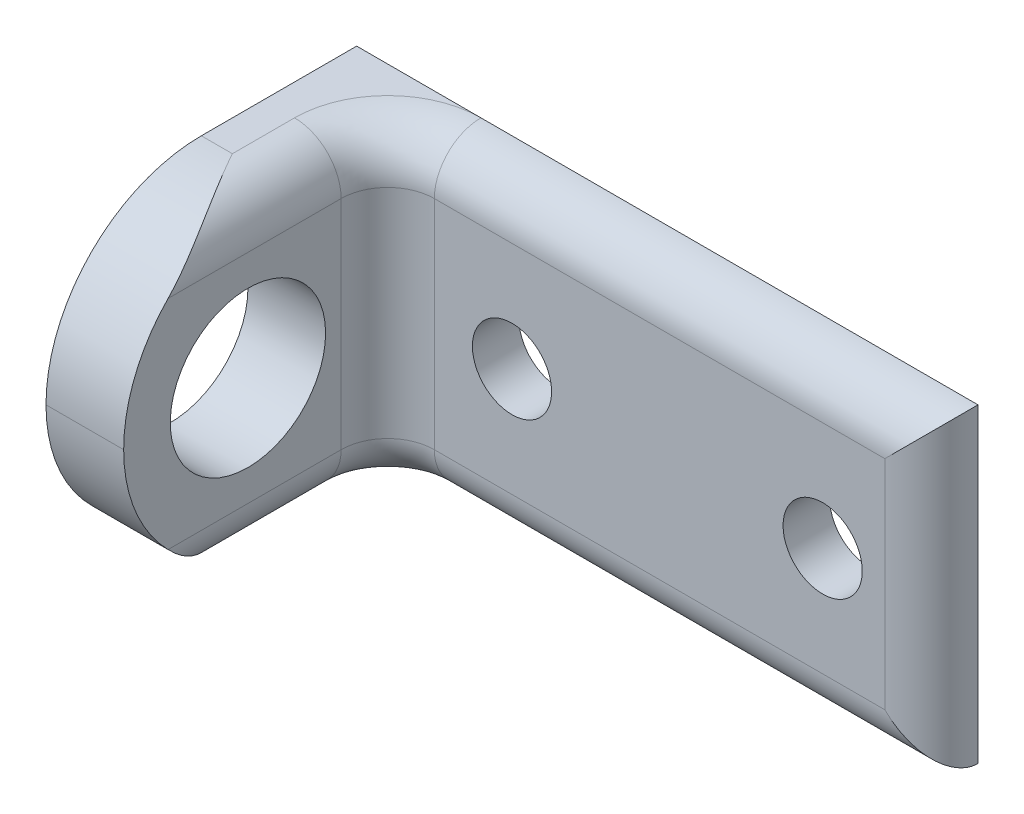
from build123d import *
from OCP.BRepFilletAPI import BRepFilletAPI_MakeFillet

# Parameters (mm, degrees)
SKETCH1_W           = 40
SKETCH1_H           = 20
BOSS_EXTRUDE1_DEPTH = 3
SKETCH2_W           = 5
SKETCH2_H           = 20
BOSS_EXTRUDE2_DEPTH = 20
SKETCH3_R           = 5
CUT_EXTRUDE1_DEPTH  = 31
FILLET2_R           = 10
FILLET2_R_2         = 3
SKETCH4_R           = 2.55
CUT_EXTRUDE2_DEPTH  = 31.000000167


with BuildPart() as part:
    # Sketch1 → Boss-Extrude1 (new body)
    with BuildSketch(Plane.XY):
        Rectangle(SKETCH1_W, SKETCH1_H)
    extrude(amount=BOSS_EXTRUDE1_DEPTH)

    # Sketch2 → Boss-Extrude2 (add)
    with BuildSketch(Plane.XY):
        with Locations((-17.5, 0)):
            Rectangle(SKETCH2_W, SKETCH2_H)
    extrude(amount=BOSS_EXTRUDE2_DEPTH)

    # Sketch3 → Cut-Extrude1 (cut, through all)
    with BuildSketch(Plane(origin=(0, 0, 0), x_dir=(0, 0, -1), z_dir=(1, 0, 0))):
        with Locations((-12, 0)):
            Circle(SKETCH3_R)
    extrude(amount=-CUT_EXTRUDE1_DEPTH, mode=Mode.SUBTRACT)

    # Fillet2
    fillet2_edges_1 = [part.edges().sort_by_distance(p)[0] for p in [
        (-17.5, -10, 20),
        (-17.5, 10, 20),
    ]]
    fillet2_edges_2 = [part.edges().sort_by_distance(p)[0] for p in [
        (2.5, -10, 3),
        (-15, -10, 11.5),
        (-15, 0, 3),
        (-15, 10, 11.5),
        (20, 0, 3),
        (2.5, 10, 3),
    ]]
    fillet2 = BRepFilletAPI_MakeFillet(part.part.solid().wrapped)
    for e in fillet2_edges_1:
        fillet2.Add(FILLET2_R - 0.0001, e.wrapped)
    for e in fillet2_edges_2:
        fillet2.Add(FILLET2_R_2 - 0.0001, e.wrapped)
    add(Compound.cast(fillet2.Shape()), mode=Mode.REPLACE)  # a hair under: the kernel refuses the full size

    # Sketch4 → Cut-Extrude2 (cut, through all)
    with BuildSketch(Plane.XY):
        with Locations(Location((13, 0, 0), (0, 0, 180))):
            Circle(SKETCH4_R)
        with Locations(Location((-7, 0, 0), (0, 0, 180))):
            Circle(SKETCH4_R)
    extrude(amount=CUT_EXTRUDE2_DEPTH, mode=Mode.SUBTRACT)


solid = part.part
